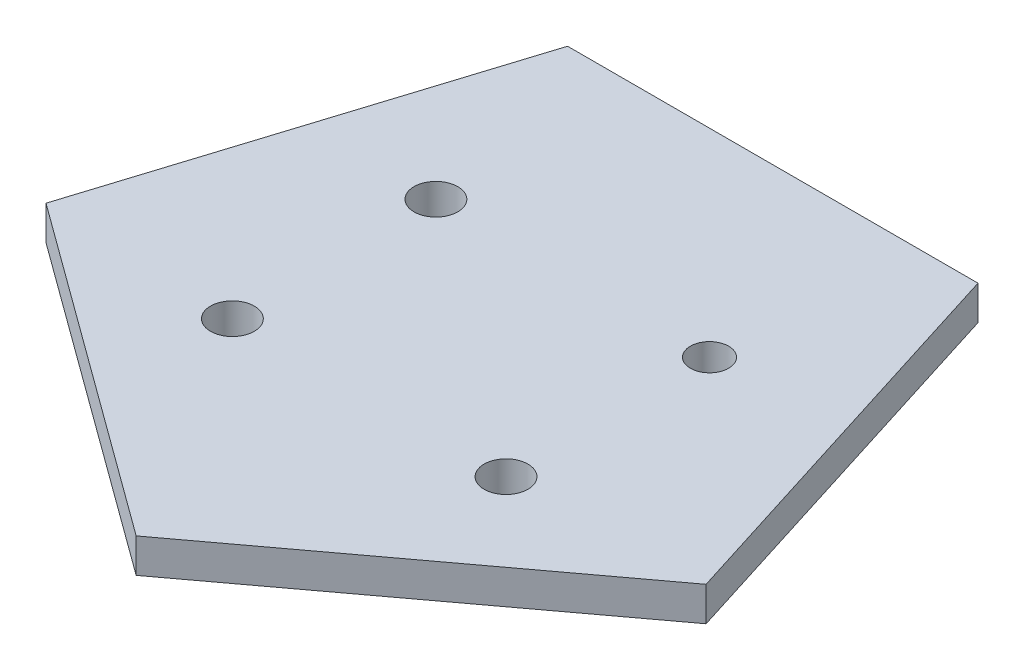
from build123d import *

# Parameters (mm, degrees)
BOSS_EXTRUDE1_DEPTH = 1.5875
SKETCH2_R           = 1.778
SKETCH2_R_2         = 2.032
CUT_EXTRUDE1_DEPTH  = 78.500788069


with BuildPart() as part:
    # Sketch1 → Boss-Extrude1 (new, symmetric)
    with BuildSketch(Plane(origin=(0, 0, 0), x_dir=(1, 0, 0), z_dir=(0, 1, 0))):
        Polygon((0, 0), (-11.58875, -36.83), (19.343746859, -59.391242197), (49.68875, -36.83), (38.1, 0), align=None)
    extrude(amount=BOSS_EXTRUDE1_DEPTH, both=True)

    # Sketch2 → Cut-Extrude1 (cut, through all)
    with BuildSketch(Plane(origin=(0, 1.5875, 0), x_dir=(1, 0, 0), z_dir=(0, 1, 0))):
        with Locations((31.59125, -18.415)):
            Circle(SKETCH2_R)
        with Locations((6.19125, -18.415)):
            Circle(SKETCH2_R_2)
        with Locations((6.35, -37.465)):
            Circle(SKETCH2_R_2)
        with Locations((31.75, -37.465)):
            Circle(SKETCH2_R_2)
    extrude(amount=-CUT_EXTRUDE1_DEPTH, mode=Mode.SUBTRACT)


solid = part.part
